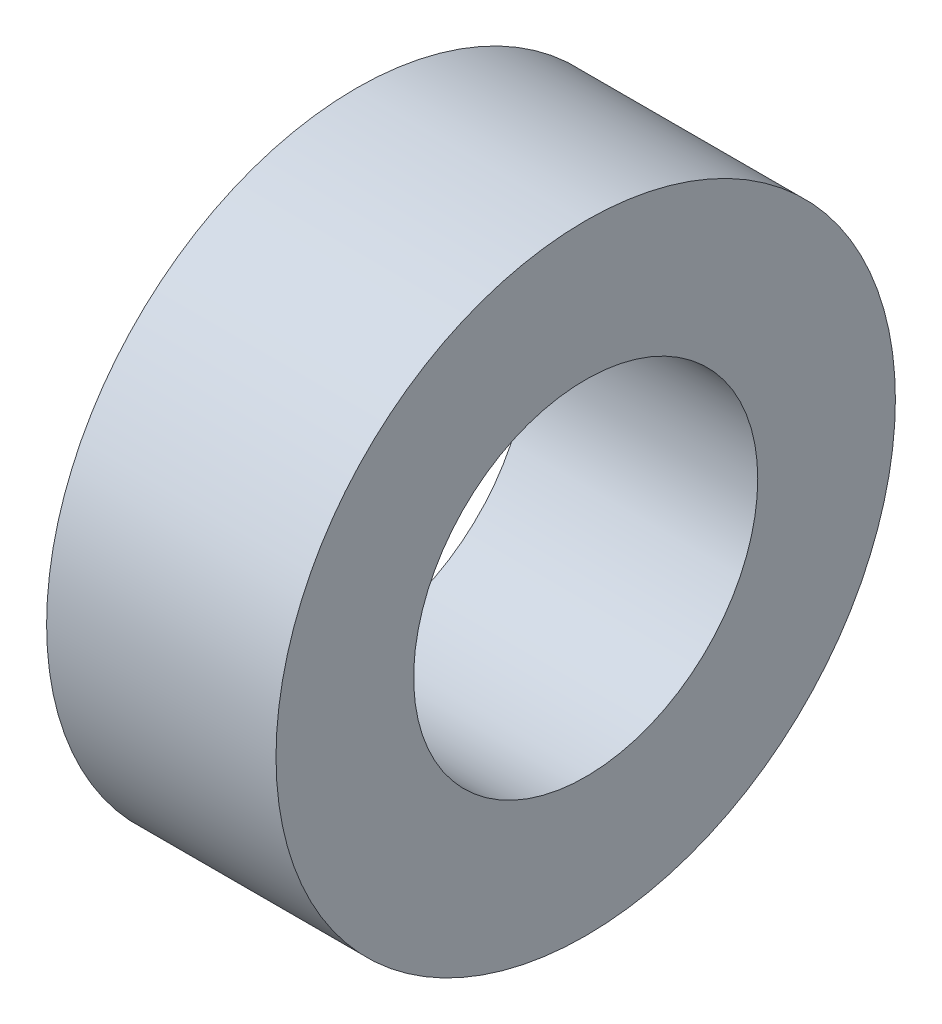
from build123d import *

# Parameters (mm, degrees)
SKIZZE1_R                       = 6.75
AUFSATZ_LINEAR_AUSTRAGEN1_DEPTH = 5
SKIZZE2_R                       = 3.75
SCHNITT_LINEAR_AUSTRAGEN1_DEPTH = 5


with BuildPart() as part:
    # Skizze1 → Aufsatz-Linear austragen1 (new body)
    with BuildSketch(Plane.YZ):
        Circle(SKIZZE1_R)
    extrude(amount=AUFSATZ_LINEAR_AUSTRAGEN1_DEPTH)

    # Skizze2 → Schnitt-Linear austragen1 (cut)
    with BuildSketch(Plane.YZ):
        Circle(SKIZZE2_R)
    extrude(amount=SCHNITT_LINEAR_AUSTRAGEN1_DEPTH, mode=Mode.SUBTRACT)


solid = part.part
